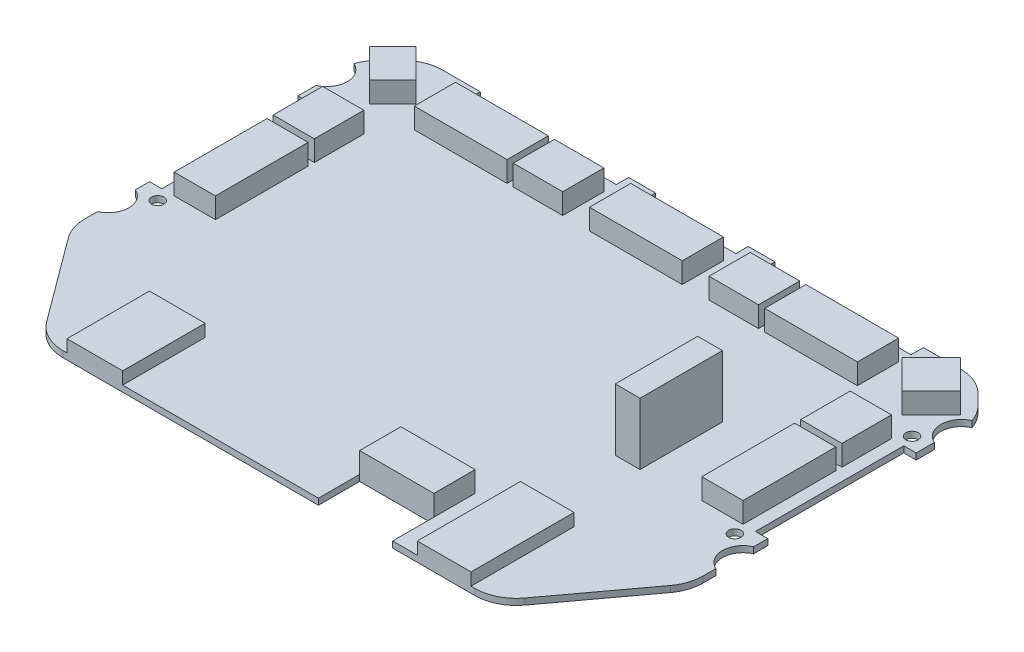
from build123d import *

# Parameters (mm, degrees)
SKETCH_2_R      = 1.5
EXTRUDE_1_DEPTH = 1.5
SKETCH_3_W      = 22.5
SKETCH_3_H      = 10
SKETCH_3_W_2    = 12
SKETCH_3_W_3    = 10
SKETCH_3_H_2    = 12
SKETCH_3_H_3    = 22.5
SKETCH_3_W_4    = 18
EXTRUDE_2_DEPTH = 5
SKETCH_4_W      = 6
SKETCH_4_H      = 20
EXTRUDE_3_DEPTH = 15
FILLET_1_R      = 10
SKETCH_6_W      = 13.5
SKETCH_6_H      = 20
SKETCH_6_W_2    = 13
SKETCH_6_H_2    = 25
EXTRUDE_5_DEPTH = 3


with BuildPart() as part:
    # 草图2 → 凸台-拉伸1 (new body)
    # profile 1 of 3: a face of its own
    with BuildSketch(Plane(origin=(0, 0, 0), x_dir=(1, 0, 0), z_dir=(0, 1, 0))):
        with BuildLine():
            Line((250.604175692, 167.040097328), (237.354175692, 167.040097328))
            Line((237.354175692, 167.040097328), (229.354175692, 159.040097328))
            Line((229.354175692, 159.040097328), (229.354175692, 157.622673023))
            ThreePointArc((229.354175692, 157.622673023), (231.537475825, 155.778710115), (232.354175692, 153.040097328))
            ThreePointArc((232.354175692, 153.040097328), (231.537475825, 150.30148454), (229.354175692, 148.457521633))
            Line((229.354175692, 148.457521633), (229.354175692, 144.040097328))
            Line((229.354175692, 144.040097328), (232.354175692, 144.040097328))
            Line((232.354175692, 144.040097328), (232.354175692, 108.040097328))
            Line((232.354175692, 108.040097328), (229.354175692, 108.040097328))
            Line((229.354175692, 108.040097328), (229.354175692, 104.622673023))
            ThreePointArc((229.354175692, 104.622673023), (231.537475825, 102.778710115), (232.354175692, 100.040097328))
            ThreePointArc((232.354175692, 100.040097328), (231.537475825, 97.30148454), (229.354175692, 95.457521633))
            Line((229.354175692, 95.457521633), (229.354175692, 89.040097328))
            Line((229.354175692, 89.040097328), (248.966003356, 62.564129981))
            ThreePointArc((248.966003356, 62.564129981), (249.273338447, 62.30138118), (249.581919942, 62.040097328))
            Line((249.581919942, 62.040097328), (316.354175692, 62.040097328))
            Line((316.354175692, 62.040097328), (316.354175692, 72.040097328))
            Line((316.354175692, 72.040097328), (334.354175692, 72.040097328))
            Line((334.354175692, 72.040097328), (334.354175692, 62.040097328))
            Line((334.354175692, 62.040097328), (359.126431443, 62.040097328))
            ThreePointArc((359.126431443, 62.040097328), (359.435012937, 62.30138118), (359.742348028, 62.564129981))
            Line((359.742348028, 62.564129981), (379.354175692, 89.040097328))
            Line((379.354175692, 89.040097328), (379.354175692, 95.457521633))
            ThreePointArc((379.354175692, 95.457521633), (376.354175692, 100.040097328), (379.354175692, 104.622673023))
            Line((379.354175692, 104.622673023), (379.354175692, 108.040097328))
            Line((379.354175692, 108.040097328), (376.354175692, 108.040097328))
            Line((376.354175692, 108.040097328), (376.354175692, 144.040097328))
            Line((376.354175692, 144.040097328), (379.354175692, 144.040097328))
            Line((379.354175692, 144.040097328), (379.354175692, 148.457521633))
            ThreePointArc((379.354175692, 148.457521633), (376.354175692, 153.040097328), (379.354175692, 157.622673023))
            Line((379.354175692, 157.622673023), (379.354175692, 159.040097328))
            Line((379.354175692, 159.040097328), (371.354175692, 167.040097328))
            Line((371.354175692, 167.040097328), (358.104175692, 167.040097328))
            Line((358.104175692, 167.040097328), (358.104175692, 164.040097328))
            Line((358.104175692, 164.040097328), (322.104175692, 164.040097328))
            Line((322.104175692, 164.040097328), (322.104175692, 167.040097328))
            Line((322.104175692, 167.040097328), (315.604175692, 167.040097328))
            Line((315.604175692, 167.040097328), (315.604175692, 164.040097328))
            Line((315.604175692, 164.040097328), (293.104175692, 164.040097328))
            Line((293.104175692, 164.040097328), (293.104175692, 167.040097328))
            Line((293.104175692, 167.040097328), (286.604175692, 167.040097328))
            Line((286.604175692, 167.040097328), (286.604175692, 164.040097328))
            Line((286.604175692, 164.040097328), (250.604175692, 164.040097328))
            Line((250.604175692, 164.040097328), (250.604175692, 167.040097328))
        make_face()
        with Locations(Location((234.354175692, 105.052003777, 0), (0, 0, 270))):
            Circle(SKETCH_2_R, mode=Mode.SUBTRACT)
        with Locations(Location((374.354175692, 105.052003777, 0), (0, 0, 270))):
            Circle(SKETCH_2_R, mode=Mode.SUBTRACT)
        with Locations(Location((233.354175692, 147.040097328, 0), (0, 0, 270))):
            Circle(SKETCH_2_R, mode=Mode.SUBTRACT)
        with Locations(Location((375.354175692, 147.040097328, 0), (0, 0, 270))):
            Circle(SKETCH_2_R, mode=Mode.SUBTRACT)
    # profile 2 of 3: a face of its own
    with BuildSketch(Plane(origin=(0, 0, 0), x_dir=(1, 0, 0), z_dir=(0, 1, 0))):
        with BuildLine():
            ThreePointArc((249.581919942, 62.040097328), (249.273338447, 62.30138118), (248.966003356, 62.564129981))
            Line((248.966003356, 62.564129981), (249.354175692, 62.040097328))
            Line((249.354175692, 62.040097328), (249.581919942, 62.040097328))
        make_face()
    # profile 3 of 3: a face of its own
    with BuildSketch(Plane(origin=(0, 0, 0), x_dir=(1, 0, 0), z_dir=(0, 1, 0))):
        with BuildLine():
            ThreePointArc((359.742348028, 62.564129981), (359.435012937, 62.30138118), (359.126431443, 62.040097328))
            Line((359.126431443, 62.040097328), (359.354175692, 62.040097328))
            Line((359.354175692, 62.040097328), (359.742348028, 62.564129981))
        make_face()
    extrude(amount=EXTRUDE_1_DEPTH)

    # 草图3 → 凸台-拉伸2 (add)
    with BuildSketch(Plane(origin=(0, 1.5, 0), x_dir=(1, 0, 0), z_dir=(0, 1, 0))):
        with Locations((261.854175692, 156.040097328)):
            Rectangle(SKETCH_3_W, SKETCH_3_H)
        with Locations((280.604175692, 156.040097328)):
            Rectangle(SKETCH_3_W_2, SKETCH_3_H)
        with Locations((304.354175692, 156.040097328)):
            Rectangle(SKETCH_3_W, SKETCH_3_H)
        with Locations((328.104175692, 156.040097328)):
            Rectangle(SKETCH_3_W_2, SKETCH_3_H)
        with Locations((346.854175692, 156.040097328)):
            Rectangle(SKETCH_3_W, SKETCH_3_H)
        with Locations((368.354175692, 138.040097328)):
            Rectangle(SKETCH_3_W_3, SKETCH_3_H_2)
        with Locations((368.354175692, 119.290097328)):
            Rectangle(SKETCH_3_W_3, SKETCH_3_H_3)
        with Locations((240.354175692, 138.040097328)):
            Rectangle(SKETCH_3_W_3, SKETCH_3_H_2)
        with Locations((240.354175692, 119.290097328)):
            Rectangle(SKETCH_3_W_3, SKETCH_3_H_3)
        Polygon((232.647068911, 158.090349859), (238.30392316, 163.747204109), (245.374990972, 156.676136297), (239.718136723, 151.019282048), align=None)
        Polygon((369.697321443, 164.45431089), (376.768389254, 157.383243078), (369.697321443, 150.312175266), (362.626253631, 157.383243078), align=None)
        with Locations((325.354175692, 77.040097328)):
            Rectangle(SKETCH_3_W_4, SKETCH_3_H)
    extrude(amount=EXTRUDE_2_DEPTH)

    # 草图4 → 凸台-拉伸3 (add)
    with BuildSketch(Plane(origin=(0, 1.5, 0), x_dir=(1, 0, 0), z_dir=(0, 1, 0))):
        with Locations((346.354175692, 117.040097328)):
            Rectangle(SKETCH_4_W, SKETCH_4_H)
    extrude(amount=EXTRUDE_3_DEPTH)

    # 圆角1
    # the kernel refuses this fillet: 10 mm, written as the material it takes off along each edge
    with BuildSketch(Plane(origin=(229.354175692, -8.403282896, -159.040097328), x_dir=(0.7071067811865475, 0, -0.7071067811865475), z_dir=(0, 1, 0))) as fillet_1_piece_1:
        with BuildLine():
            CenterArc((3.361313158, -10), FILLET_1_R, 90, 25.871759313)
            Line((-1.002270338, -1.002270338), (-1.089542008, -0.822315745))
            ThreePointArc((-1.089542008, -0.822315745), (-0.642556525, -0.359713813), (-0.141421356, 0.141421356))
            Line((-0.141421356, 0.141421356), (0, 0.2))
            Line((0, 0.2), (3.361313158, 0.2))
            Line((3.361313158, 0.2), (3.361313158, 0))
        make_face()
    extrude(amount=18.306565791, mode=Mode.SUBTRACT)
    with BuildSketch(Plane(origin=(237.354175692, -10.355339059, -167.040097328), x_dir=(1, 0, 0), z_dir=(0, 1, 0)), Plane(origin=(371.354175692, -10.355339059, -167.040097328), x_dir=(0.707106781186544, 0, 0.7071067811865509), z_dir=(0, 1, 0))) as fillet_1_piece_2:
        with BuildLine():
            CenterArc((FILLET_1_R * 0.414213562373, -FILLET_1_R), FILLET_1_R, 90, 45)
            Line((-FILLET_1_R * 0.292893218813, -FILLET_1_R * 0.292893218813), (-FILLET_1_R * 0.307035354437, -FILLET_1_R * 0.27875108319))
            Line((-FILLET_1_R * 0.307035354437, -FILLET_1_R * 0.27875108319), (-FILLET_1_R * 0.00828427124746, FILLET_1_R * 0.02))
            Line((-FILLET_1_R * 0.00828427124746, FILLET_1_R * 0.02), (FILLET_1_R * 0.414213562373, FILLET_1_R * 0.02))
            Line((FILLET_1_R * 0.414213562373, FILLET_1_R * 0.02), (FILLET_1_R * 0.414213562373, 0))
        make_face()
    extrude(amount=22.210678119, mode=Mode.SUBTRACT)
    with BuildSketch(Plane(origin=(379.354175692, -8.403282896, -159.040097328), x_dir=(0, 0, 1), z_dir=(0, 1, 0))) as fillet_1_piece_3:
        with BuildLine():
            CenterArc((4.694260484, -9.44787514), FILLET_1_R, 109.128240687, 25.871759313)
            Line((-2.376807328, -2.376807328), (-2.518228684, -2.235385972))
            Line((-2.518228684, -2.235385972), (-0.141421356, 0.141421356))
            Line((-0.141421356, 0.141421356), (0, 0.2))
            ThreePointArc((0, 0.2), (0.708712153, 0.2), (1.351887581, 0.188957503))
            Line((1.351887581, 0.188957503), (1.417424305, 0))
        make_face()
    extrude(amount=18.306565791, mode=Mode.SUBTRACT)
    with BuildSketch(Plane(origin=(379.354175692, -8.250744041, -89.040097328), x_dir=(0, 0, -1), z_dir=(0, 1, 0))) as fillet_1_piece_4:
        with BuildLine():
            CenterArc((FILLET_1_R * 0.330029761641, FILLET_1_R), FILLET_1_R, 233.471144633, 36.528855367)
            Line((-FILLET_1_R * 0.265197788985, FILLET_1_R * 0.196442806655), (-FILLET_1_R * 0.277102339997, FILLET_1_R * 0.180371662788))
            Line((-FILLET_1_R * 0.277102339997, FILLET_1_R * 0.180371662788), (-FILLET_1_R * 0.00660059523282, -FILLET_1_R * 0.02))
            Line((-FILLET_1_R * 0.00660059523282, -FILLET_1_R * 0.02), (FILLET_1_R * 0.330029761641, -FILLET_1_R * 0.02))
            Line((FILLET_1_R * 0.330029761641, -FILLET_1_R * 0.02), (FILLET_1_R * 0.330029761641, 0))
        make_face()
    extrude(amount=18.001488082, mode=Mode.SUBTRACT)
    with BuildSketch(Plane(origin=(359.354175692, -12.593143734, -62.040097328), x_dir=(0.5952275506257363, 0, -0.8035571933447467), z_dir=(0, 1, 0))) as fillet_1_piece_5:
        with BuildLine():
            CenterArc((FILLET_1_R * 0.503725749364, FILLET_1_R), FILLET_1_R, 216.528855367, 53.471144633)
            Line((-FILLET_1_R * 0.299831443981, FILLET_1_R * 0.404772449374), (-FILLET_1_R * 0.315902587848, FILLET_1_R * 0.392867898362))
            Line((-FILLET_1_R * 0.315902587848, FILLET_1_R * 0.392867898362), (-FILLET_1_R * 0.0100745149873, -FILLET_1_R * 0.02))
            Line((-FILLET_1_R * 0.0100745149873, -FILLET_1_R * 0.02), (FILLET_1_R * 0.503725749364, -FILLET_1_R * 0.02))
            Line((FILLET_1_R * 0.503725749364, -FILLET_1_R * 0.02), (FILLET_1_R * 0.503725749364, 0))
        make_face()
    extrude(amount=26.686287468, mode=Mode.SUBTRACT)
    with BuildSketch(Plane(origin=(249.354175692, -12.593143734, -62.040097328), x_dir=(-0.5952275506257363, 0, -0.8035571933447467), z_dir=(0, 1, 0))) as fillet_1_piece_6:
        with BuildLine():
            CenterArc((FILLET_1_R * 0.503725749364, -FILLET_1_R), FILLET_1_R, 90, 53.471144633)
            Line((-FILLET_1_R * 0.299831443981, -FILLET_1_R * 0.404772449374), (-FILLET_1_R * 0.315902587848, -FILLET_1_R * 0.392867898362))
            Line((-FILLET_1_R * 0.315902587848, -FILLET_1_R * 0.392867898362), (-FILLET_1_R * 0.0100745149873, FILLET_1_R * 0.02))
            Line((-FILLET_1_R * 0.0100745149873, FILLET_1_R * 0.02), (FILLET_1_R * 0.503725749364, FILLET_1_R * 0.02))
            Line((FILLET_1_R * 0.503725749364, FILLET_1_R * 0.02), (FILLET_1_R * 0.503725749364, 0))
        make_face()
    extrude(amount=26.686287468, mode=Mode.SUBTRACT)
    with BuildSketch(Plane(origin=(229.354175692, -8.250744041, -89.040097328), x_dir=(0, 0, -1), z_dir=(0, 1, 0))) as fillet_1_piece_7:
        with BuildLine():
            CenterArc((FILLET_1_R * 0.330029761641, -FILLET_1_R), FILLET_1_R, 90, 36.528855367)
            Line((-FILLET_1_R * 0.265197788985, -FILLET_1_R * 0.196442806655), (-FILLET_1_R * 0.277102339997, -FILLET_1_R * 0.180371662788))
            Line((-FILLET_1_R * 0.277102339997, -FILLET_1_R * 0.180371662788), (-FILLET_1_R * 0.00660059523282, FILLET_1_R * 0.02))
            Line((-FILLET_1_R * 0.00660059523282, FILLET_1_R * 0.02), (FILLET_1_R * 0.330029761641, FILLET_1_R * 0.02))
            Line((FILLET_1_R * 0.330029761641, FILLET_1_R * 0.02), (FILLET_1_R * 0.330029761641, 0))
        make_face()
    extrude(amount=18.001488082, mode=Mode.SUBTRACT)

    # 草图6 → 凸台-拉伸5 (add)
    with BuildSketch(Plane(origin=(0, 1.5, 0), x_dir=(1, 0, 0), z_dir=(0, 1, 0))):
        with Locations((262.104175692, 72.040097328)):
            Rectangle(SKETCH_6_W, SKETCH_6_H)
        with Locations((346.854175692, 74.540097328)):
            Rectangle(SKETCH_6_W_2, SKETCH_6_H_2)
    extrude(amount=EXTRUDE_5_DEPTH)


solid = part.part
